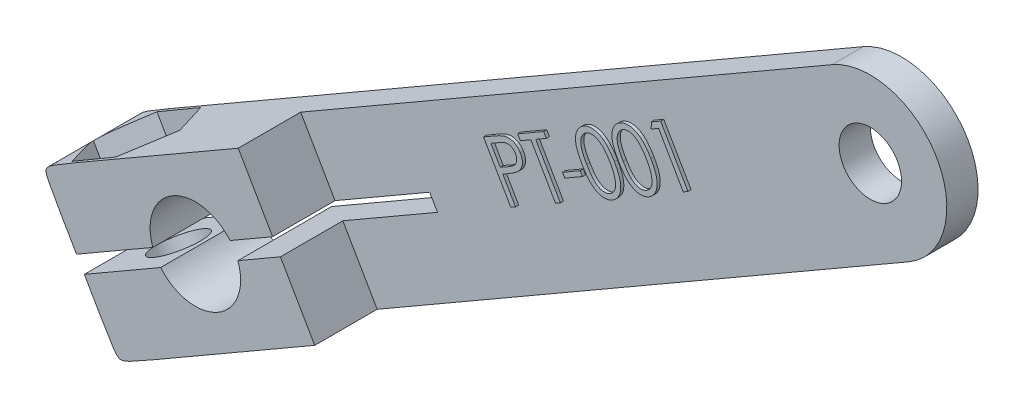
from build123d import *

# Parameters (mm, degrees)
SCHIZZO1_R                        = 2.9
SCHIZZO1_R_2                      = 2
ESTRUSIONE_ESTRUSIONE1_DEPTH      = 2
ESTRUSIONE_ESTRUSIONE2_DEPTH      = 4
ESTRUSIONE_ESTRUSIONE2_DEPTH_BACK = 2
SCHIZZO2_R                        = 2.9
TAGLIO_ESTRUSIONE1_START          = -6
TAGLIO_ESTRUSIONE1_DEPTH          = 6
SCHIZZO4_R                        = 1.6
TAGLIO_ESTRUSIONE2_DEPTH          = 13
TAGLIO_ESTRUSIONE3_DEPTH          = 2.4
TAGLIO_ESTRUSIONE4_DEPTH          = 3.5
RACCORDO2_SIZE                    = 2.5
ESTRUSIONE_ESTRUSIONE3_DEPTH      = 0.2


with BuildPart() as part:
    # Schizzo1 → Estrusione-Estrusione1 (new body)
    with BuildSketch(Plane.XY):
        with BuildLine():
            Line((2.45, -4.243524479), (41.680950791, 18.406475521))
            ThreePointArc((41.680950791, 18.406475521), (43.47447527, 25.1), (36.780950791, 26.893524479))
            Line((36.780950791, 26.893524479), (-2.45, 4.243524479))
            ThreePointArc((-2.45, 4.243524479), (-4.243524479, -2.45), (2.45, -4.243524479))
        make_face()
        Circle(SCHIZZO1_R, mode=Mode.SUBTRACT)
        with Locations((39.230950791, 22.65)):
            Circle(SCHIZZO1_R_2, mode=Mode.SUBTRACT)
    extrude(amount=ESTRUSIONE_ESTRUSIONE1_DEPTH)

    # Schizzo2 → Estrusione-Estrusione2 (add, two sides: drawn at the far end of the back side and taken through both)
    with BuildSketch(Plane.XY.offset(2).offset(-ESTRUSIONE_ESTRUSIONE2_DEPTH_BACK)):
        Polygon((-12.842304845, -1.756475521), (-7.942304845, -10.243524479), (7.646152423, -1.243524479), (2.746152423, 7.243524479), align=None)
        Circle(SCHIZZO2_R, mode=Mode.SUBTRACT)
    extrude(amount=ESTRUSIONE_ESTRUSIONE2_DEPTH + ESTRUSIONE_ESTRUSIONE2_DEPTH_BACK)

    # Schizzo3 → Taglio-Estrusione1 (cut)
    with BuildSketch(Plane.XY.offset(6).offset(TAGLIO_ESTRUSIONE1_START)):
        Polygon((11.008330249, 6.933012702), (4.946152423, 3.433012702), (5.446152423, 2.566987298), (11.508330249, 6.066987298), align=None)
        with BuildLine():
            Line((4.946152423, 3.433012702), (2.223863375, 1.861298388))
            ThreePointArc((2.223863375, 1.861298388), (2.511473671, 1.45), (2.723863375, 0.995272984))
            Line((2.723863375, 0.995272984), (5.446152423, 2.566987298))
            Line((5.446152423, 2.566987298), (4.946152423, 3.433012702))
        make_face()
        with BuildLine():
            ThreePointArc((-2.223863375, -1.861298388), (-2.376582804, -1.66188272), (-2.511473671, -1.45))
            Line((-2.511473671, -1.45), (-10.392304845, -6))
            Line((-10.392304845, -6), (-10.142304845, -6.433012702))
            Line((-10.142304845, -6.433012702), (-2.223863375, -1.861298388))
        make_face()
        with BuildLine():
            Line((-10.392304845, -6), (-2.511473671, -1.45))
            ThreePointArc((-2.511473671, -1.45), (-2.627524055, -1.227239723), (-2.723863375, -0.995272984))
            Line((-2.723863375, -0.995272984), (-10.642304845, -5.566987298))
            Line((-10.642304845, -5.566987298), (-10.392304845, -6))
        make_face()
    extrude(amount=TAGLIO_ESTRUSIONE1_DEPTH, mode=Mode.SUBTRACT)

    # Schizzo4 → Taglio-Estrusione2 (cut)
    with BuildSketch(Plane(origin=(2.45, -4.243524479, 0), x_dir=(0.8660254037844386, 0.5000000000000001, 0), z_dir=(0.5000000000000001, -0.8660254037844386, 0))):
        with Locations((-5, 3)):
            Circle(SCHIZZO4_R)
    extrude(amount=-TAGLIO_ESTRUSIONE2_DEPTH, mode=Mode.SUBTRACT)

    # Schizzo5 → Taglio-Estrusione3 (cut)
    with BuildSketch(Plane(origin=(-2.45, 4.243524479, 0), x_dir=(0.8660254037844386, 0.5000000000000003, 0), z_dir=(-0.5000000000000003, 0.8660254037844386, 0))):
        Polygon((-6.628973785, -0.267594464), (-8.1808195, -3.044529912), (-6.551845715, -5.776935448), (-3.371026215, -5.732405536), (-1.8191805, -2.955470088), (-3.448154285, -0.223064552), align=None)
    extrude(amount=-TAGLIO_ESTRUSIONE3_DEPTH, mode=Mode.SUBTRACT)

    # Schizzo6 → Taglio-Estrusione4 (cut)
    with BuildSketch(Plane(origin=(-10.392304845, -6, 0), x_dir=(0, 0, 1), z_dir=(-0.8660254037844385, -0.5000000000000004, 0))):
        Polygon((6, 4.9), (6, 0.5), (2, 0.5), (2, -0.5), (6, -0.5), (6, -4.9), (2, -4.9), (0, -4.9), (0, 4.9), (2, 4.9), align=None)
    extrude(amount=-TAGLIO_ESTRUSIONE4_DEPTH, mode=Mode.SUBTRACT)

    # Raccordo2
    # a fillet whose section is not a circle: 2.5 mm, written as the material it takes off along each edge
    with BuildSketch(Plane(origin=(-4.911215932, -8.493524479, -6.25), x_dir=(0.8660254037844352, 0.500000000000006, 0), z_dir=(0, 0, 1)), Plane(origin=(-9.811215932, -0.006475521, 12.25), x_dir=(0.8660254037844352, 0.500000000000006, 0), z_dir=(0, 0, -1))) as raccordo2_piece_1:
        with BuildLine():
            Bezier((RACCORDO2_SIZE, 0), (0, 0), (0, RACCORDO2_SIZE), weights=[1, 5.666666667, 1])
            Line((0, RACCORDO2_SIZE), (0, 0))
            Line((0, 0), (RACCORDO2_SIZE, 0))
        make_face()
    extrude(amount=18.5, mode=Mode.SUBTRACT)

    # Schizzo7 → Estrusione-Estrusione3 (add)
    # profile 1 of 6: a face of its own
    with BuildSketch(Plane.XY.offset(2)):
        with BuildLine():
            Line((14.654995983, 11.923657971), (15.258661848, 12.272115503))
            add(Edge.make_bspline(
                [(15.258661848, 12.272115503), (15.300199252, 12.296062866), (15.379710941, 12.341903363), (15.49480711, 12.405967766), (15.600367035, 12.461803713), (15.696128258, 12.510571645), (15.781872788, 12.551836711), (15.857909757, 12.585931874), (15.924221158, 12.612398451), (15.966013794, 12.625245926), (15.985024028, 12.631089862)],
                knots=[0, 0, 0, 0, 1.41763798, 2.713669593, 3.894493283, 4.948305046, 5.890974387, 6.707656998, 7.412151409, 8, 8, 8, 8], degree=3))
            add(Edge.make_bspline(
                [(15.985024028, 12.631089862), (16.009476955, 12.637551709), (16.058012193, 12.650377466), (16.131682799, 12.662671995), (16.204763374, 12.670027753), (16.277272429, 12.670737565), (16.349008963, 12.664968908), (16.420239163, 12.653608553), (16.491172644, 12.636976767), (16.560971017, 12.613722569), (16.62921227, 12.585158783), (16.694591436, 12.550093521), (16.756271399, 12.508389585), (16.815220059, 12.4613289), (16.869570151, 12.406776262), (16.921541702, 12.347214035), (16.970622429, 12.281664127), (16.999035705, 12.234064095), (17.013569701, 12.209715663)],
                knots=[0, 0, 0, 0, 1.006970065, 1.998678183, 2.971283936, 3.930160629, 4.882599096, 5.834537011, 6.800930537, 7.781213065, 8.761539793, 9.744470784, 10.730746285, 11.723720646, 12.744027512, 13.793144763, 14.871146497, 16, 16, 16, 16], degree=3))
            add(Edge.make_bspline(
                [(17.013569701, 12.209715663), (17.027580474, 12.184703935), (17.054948127, 12.135847793), (17.087515607, 12.060168678), (17.114769185, 11.985689722), (17.134464387, 11.911057044), (17.147105101, 11.836903108), (17.152871557, 11.763206537), (17.151477341, 11.689940411), (17.142891364, 11.617238562), (17.128363609, 11.545605098), (17.106818636, 11.47592327), (17.080610481, 11.407478648), (17.046471417, 11.341689521), (17.006890294, 11.277638989), (16.962130198, 11.214740518), (16.90985103, 11.154604013), (16.871708112, 11.116441675), (16.852311688, 11.097035375)],
                knots=[0, 0, 0, 0, 1.122828736, 2.193254318, 3.224643453, 4.228831758, 5.213617705, 6.169000406, 7.121745138, 8.080633842, 9.034478614, 9.981969644, 10.936166161, 11.902896885, 12.881572857, 13.88563584, 14.924804262, 16, 16, 16, 16], degree=3))
            add(Edge.make_bspline(
                [(16.852311688, 11.097035375), (16.835677964, 11.081849117), (16.799492904, 11.048812878), (16.736118193, 11.000322569), (16.66195324, 10.945294372), (16.574828928, 10.886216899), (16.476177132, 10.821583488), (16.364848352, 10.753253223), (16.242293353, 10.678528448), (16.155731035, 10.628283337), (16.110524829, 10.602043388)],
                knots=[0, 0, 0, 0, 0.604898426, 1.315898124, 2.142283095, 3.086283746, 4.14345829, 5.310927923, 6.595662065, 8, 8, 8, 8], degree=3))
            Line((16.110524829, 10.602043388), (15.894579316, 10.47794483))
            Line((15.894579316, 10.47794483), (16.707880598, 9.069391144))
            Line((16.707880598, 9.069391144), (16.404995983, 8.894110696))
            Line((16.404995983, 8.894110696), (14.654995983, 11.923657971))
        make_face()
        with BuildLine():
            Line((15.128253195, 11.804467266), (15.722804477, 10.774519349))
            Line((15.722804477, 10.774519349), (16.23953124, 11.064082651))
            add(Edge.make_bspline(
                [(16.23953124, 11.064082651), (16.264683131, 11.078569446), (16.313154228, 11.10648746), (16.380914973, 11.15067851), (16.44377454, 11.191520063), (16.499637922, 11.232068537), (16.54928623, 11.271566843), (16.592343358, 11.309955244), (16.630221172, 11.346319314), (16.6708419, 11.393540916), (16.711896632, 11.454368449), (16.75026298, 11.531107013), (16.773004361, 11.613256841), (16.784333469, 11.697974001), (16.783035006, 11.783811016), (16.768568568, 11.868532555), (16.742305739, 11.951358254), (16.71479556, 12.002790336), (16.700869381, 12.02882624)],
                knots=[0, 0, 0, 0, 1.14227034, 2.201309401, 3.183612238, 4.092622455, 4.917282292, 5.679715209, 6.362759515, 6.982399264, 8.128035595, 9.243012258, 10.343627153, 11.466432026, 12.598095752, 13.708166046, 14.839829772, 16, 16, 16, 16], degree=3))
            add(Edge.make_bspline(
                [(16.700869381, 12.02882624), (16.685405959, 12.053144329), (16.654915579, 12.101094114), (16.597796598, 12.164394381), (16.531916825, 12.218001783), (16.458699297, 12.26190436), (16.380565834, 12.294762906), (16.300022061, 12.315711294), (16.217857565, 12.322508717), (16.148311995, 12.318042553), (16.090245534, 12.306593258), (16.042172896, 12.293319655), (15.990066894, 12.274402266), (15.932909479, 12.25226191), (15.871770328, 12.22381222), (15.8056577, 12.191699121), (15.735546447, 12.154438643), (15.687904553, 12.127121067), (15.663209124, 12.112960856)],
                knots=[0, 0, 0, 0, 1.162641582, 2.292466936, 3.426387301, 4.582455347, 5.729194961, 6.839764135, 7.929592866, 9.04620529, 9.642419358, 10.318104597, 11.058617802, 11.880865065, 12.793487328, 13.781520127, 14.850039147, 16, 16, 16, 16], degree=3))
            Line((15.663209124, 12.112960856), (15.128253195, 11.804467266))
        make_face(mode=Mode.SUBTRACT)
    # profile 2 of 6: a face of its own
    with BuildSketch(Plane.XY.offset(2)):
        Polygon((17.013738008, 12.892608292), (16.843365412, 13.187079446), (18.505725188, 14.146915183), (18.676097784, 13.852444029), (18.000216373, 13.462620311), (19.579843777, 10.727544189), (19.270649066, 10.548758131), (17.691021662, 13.283834253), align=None)
    # profile 3 of 6: a face of its own
    with BuildSketch(Plane.XY.offset(2)):
        Polygon((19.716267207, 12.492267747), (20.849280027, 13.147115503), (20.994412239, 12.895412779), (19.861399418, 12.240565022), align=None)
    # profile 4 of 6: a face of its own
    with BuildSketch(Plane.XY.offset(2)):
        with BuildLine():
            add(Edge.make_bspline(
                [(20.971501353, 13.548858292), (20.943796032, 13.597506048), (20.889913233, 13.692118826), (20.817381905, 13.833231527), (20.752455352, 13.967625038), (20.696926863, 14.096005359), (20.65028946, 14.218032133), (20.613126804, 14.333957611), (20.583675286, 14.443546953), (20.564039142, 14.547904358), (20.552007791, 14.647715599), (20.546520936, 14.743721325), (20.546170229, 14.836692677), (20.552488118, 14.926676926), (20.56497966, 15.01365605), (20.583958354, 15.097600337), (20.609390856, 15.178364128), (20.640196005, 15.256208454), (20.676253876, 15.330616264), (20.719112831, 15.400012818), (20.76482116, 15.466302649), (20.816573068, 15.527207536), (20.872032861, 15.584750673), (20.933301655, 15.636868985), (20.998555455, 15.685914782), (21.04533082, 15.714305609), (21.068957282, 15.728645952)],
                knots=[0, 0, 0, 0, 1.642217524, 3.193873097, 4.653599743, 6.020219012, 7.296149585, 8.484364078, 9.590266645, 10.622995624, 11.596731579, 12.537641419, 13.442669779, 14.322439731, 15.181528583, 16.018162769, 16.844365298, 17.663022962, 18.472528165, 19.266229043, 20.053716379, 20.832379209, 21.608138827, 22.395685855, 23.18965321, 24, 24, 24, 24], degree=3))
            add(Edge.make_bspline(
                [(21.068957282, 15.728645952), (21.093522926, 15.742152267), (21.142223982, 15.768928354), (21.218485196, 15.80149194), (21.295294522, 15.829277338), (21.373955184, 15.849645252), (21.453681141, 15.863595144), (21.535022864, 15.871384594), (21.617539612, 15.87273004), (21.701186829, 15.867684843), (21.785699056, 15.856741644), (21.870323652, 15.837674565), (21.954684475, 15.811237929), (22.039527134, 15.779367461), (22.123143325, 15.738168881), (22.207131052, 15.690829999), (22.291364608, 15.637102145), (22.37483412, 15.574808126), (22.459254463, 15.505046184), (22.542786922, 15.425101678), (22.62668834, 15.335554615), (22.70970006, 15.236068752), (22.792453049, 15.126685106), (22.876196878, 15.008364642), (22.958478282, 14.879238821), (23.011794301, 14.789066437), (23.039109526, 14.742868708)],
                knots=[0, 0, 0, 0, 0.815881076, 1.617473213, 2.411751612, 3.192532544, 3.980223438, 4.766442947, 5.569622482, 6.380892254, 7.204795063, 8.048528362, 8.903143009, 9.777765604, 10.684831081, 11.614241792, 12.584586996, 13.591843045, 14.645331516, 15.771781295, 16.956234458, 18.217113798, 19.542884518, 20.949560407, 22.437178076, 24, 24, 24, 24], degree=3))
            add(Edge.make_bspline(
                [(23.039109526, 14.742868708), (23.06529593, 14.696263275), (23.116367136, 14.605368948), (23.186963488, 14.470181916), (23.247602263, 14.339134523), (23.300833876, 14.213302481), (23.344851617, 14.092258576), (23.381156663, 13.976089776), (23.408591154, 13.864643899), (23.427886494, 13.757601989), (23.438621176, 13.654470209), (23.445003734, 13.555246519), (23.44303436, 13.45923215), (23.436724427, 13.366364122), (23.422239608, 13.276731042), (23.402927197, 13.190137031), (23.37692841, 13.107095552), (23.344453908, 13.027772863), (23.306915736, 12.952172401), (23.263522434, 12.881153534), (23.216933842, 12.813627136), (23.164891281, 12.750698392), (23.106749143, 12.69349093), (23.045374972, 12.639327075), (22.978948673, 12.589548623), (22.931396458, 12.560815224), (22.907298628, 12.546254125)],
                knots=[0, 0, 0, 0, 1.558572261, 3.039675171, 4.44500239, 5.767404933, 7.021920233, 8.19867626, 9.314183841, 10.366093107, 11.366862767, 12.335955634, 13.262731656, 14.164729598, 15.047477431, 15.907015182, 16.749641984, 17.580952634, 18.403702246, 19.207672054, 20.005351578, 20.794016824, 21.584181799, 22.380929523, 23.179510693, 24, 24, 24, 24], degree=3))
            add(Edge.make_bspline(
                [(22.907298628, 12.546254125), (22.883162045, 12.533074839), (22.835236664, 12.506906169), (22.760914553, 12.47367809), (22.684664147, 12.448076555), (22.607767897, 12.427200078), (22.529282967, 12.414304182), (22.449890729, 12.406259607), (22.3690082, 12.405079868), (22.287133862, 12.409681891), (22.20495126, 12.422074917), (22.122626408, 12.439765638), (22.04115803, 12.466491707), (21.959462526, 12.498594355), (21.878032801, 12.538181735), (21.796655943, 12.584390703), (21.715915421, 12.638193006), (21.634565013, 12.698565345), (21.553743449, 12.768629957), (21.472001396, 12.848412073), (21.389528413, 12.938705642), (21.306938508, 13.040173975), (21.223269988, 13.151870709), (21.139757147, 13.274641101), (21.05432809, 13.407345535), (20.999666802, 13.500736508), (20.971501353, 13.548858292)],
                knots=[0, 0, 0, 0, 0.807491903, 1.603348545, 2.386916451, 3.167713854, 3.940658363, 4.719915701, 5.50935356, 6.313835313, 7.125313705, 7.947948844, 8.783651521, 9.640150085, 10.524255013, 11.440287308, 12.386399569, 13.372019105, 14.413529699, 15.525036669, 16.724996316, 18.002813491, 19.365932914, 20.822335035, 22.362637201, 24, 24, 24, 24], degree=3))
        make_face()
        with BuildLine():
            add(Edge.make_bspline(
                [(21.261064654, 13.708012939), (21.285124583, 13.666733055), (21.331715119, 13.586797161), (21.403440772, 13.473036292), (21.473555032, 13.368673016), (21.541226964, 13.273063842), (21.607723864, 13.187283475), (21.673111134, 13.111541349), (21.736086644, 13.044410654), (21.798221378, 12.986394531), (21.859993324, 12.936036079), (21.921737541, 12.891646656), (21.984128809, 12.85313397), (22.046608268, 12.819948923), (22.109680713, 12.792402832), (22.173013116, 12.769692097), (22.237255197, 12.753872494), (22.321390307, 12.738803909), (22.424706396, 12.733034404), (22.544089462, 12.74496112), (22.657067079, 12.774430478), (22.725295116, 12.809294803), (22.75936193, 12.826702843)],
                knots=[0, 0, 0, 0, 1.475228016, 2.856686104, 4.15161897, 5.357081144, 6.47289893, 7.501387829, 8.445726694, 9.313720896, 10.124066195, 10.905058304, 11.660046733, 12.386348828, 13.08755313, 13.783651734, 14.460982071, 15.127735434, 16.421461315, 17.639985157, 18.821625413, 20, 20, 20, 20], degree=3))
            add(Edge.make_bspline(
                [(22.75936193, 12.826702843), (22.791745586, 12.847584644), (22.856146431, 12.889111938), (22.938596188, 12.971417661), (23.00750223, 13.06773642), (23.053570568, 13.158376256), (23.081991718, 13.237069359), (23.099949338, 13.299476148), (23.111460495, 13.365048874), (23.118783, 13.432992952), (23.119546473, 13.50354414), (23.117155464, 13.576633921), (23.108549006, 13.652277837), (23.099237172, 13.703154298), (23.094498148, 13.729046593)],
                knots=[0, 0, 0, 0, 1.342886321, 2.670576022, 4.038999414, 5.466462105, 6.205051725, 6.959707281, 7.731476591, 8.527516338, 9.344012544, 10.193626534, 11.080691652, 12, 12, 12, 12], degree=3))
            add(Edge.make_bspline(
                [(23.094498148, 13.729046593), (23.087879458, 13.761857634), (23.074408882, 13.828635747), (23.046402922, 13.928817012), (23.013484452, 14.031597663), (22.974372566, 14.136167865), (22.928905441, 14.242575616), (22.878607033, 14.351288915), (22.821808822, 14.462180522), (22.779975744, 14.535724732), (22.758660808, 14.573197234)],
                knots=[0, 0, 0, 0, 0.879876913, 1.790754508, 2.73331625, 3.717259664, 4.725112015, 5.77538776, 6.866507818, 8, 8, 8, 8], degree=3))
            add(Edge.make_bspline(
                [(22.758660808, 14.573197234), (22.736980816, 14.610299784), (22.694562021, 14.682894161), (22.627601977, 14.786212524), (22.561954208, 14.883529577), (22.495370437, 14.973437223), (22.427985833, 15.055832745), (22.361499935, 15.132213948), (22.294147483, 15.20085681), (22.226686436, 15.262817673), (22.159383018, 15.31810726), (22.093010894, 15.367536558), (22.026470332, 15.409747703), (21.960693663, 15.446579668), (21.89492851, 15.476520319), (21.829910993, 15.500865011), (21.765142464, 15.518566716), (21.680733993, 15.532956301), (21.578032222, 15.538879241), (21.45943899, 15.528064173), (21.347553567, 15.498319071), (21.279958702, 15.463908655), (21.246341096, 15.44679499)],
                knots=[0, 0, 0, 0, 1.327522451, 2.597413504, 3.803087542, 4.954092809, 6.052504639, 7.091116491, 8.08170511, 9.022070092, 9.919800897, 10.771882377, 11.577119672, 12.352806521, 13.099205072, 13.807429758, 14.495830891, 15.170113202, 16.450227669, 17.661618134, 18.837030004, 20, 20, 20, 20], degree=3))
            add(Edge.make_bspline(
                [(21.246341096, 15.44679499), (21.213909712, 15.425956637), (21.149275455, 15.384426758), (21.067225993, 15.301076507), (20.996904192, 15.2042144), (20.951416306, 15.111829809), (20.921155016, 15.032500689), (20.904913495, 14.969093146), (20.891982621, 14.903611206), (20.884114839, 14.835382324), (20.882665683, 14.764605522), (20.884183235, 14.691491255), (20.892702617, 14.616210751), (20.904203956, 14.537628291), (20.922844828, 14.454663653), (20.949055785, 14.366221314), (20.983123597, 14.271679171), (21.023773572, 14.170522901), (21.072340839, 14.063582481), (21.128127373, 13.950261054), (21.190871461, 13.830574482), (21.237191051, 13.749697688), (21.261064654, 13.708012939)],
                knots=[0, 0, 0, 0, 1.186584607, 2.364808541, 3.584028067, 4.867913378, 5.52979883, 6.201670858, 6.884946004, 7.589109066, 8.317961587, 9.068444384, 9.84432244, 10.65432116, 11.518850237, 12.466086659, 13.499587148, 14.619373863, 15.830028341, 17.123623296, 18.517485242, 20, 20, 20, 20], degree=3))
        make_face(mode=Mode.SUBTRACT)
    # profile 5 of 6: a face of its own
    with BuildSketch(Plane.XY.offset(2)):
        with BuildLine():
            add(Edge.make_bspline(
                [(23.303108209, 14.895012138), (23.275402889, 14.943659895), (23.22152009, 15.038272672), (23.148988761, 15.179385373), (23.084062209, 15.313778884), (23.028533719, 15.442159206), (22.981896316, 15.56418598), (22.94473366, 15.680111457), (22.915282143, 15.789700799), (22.895645998, 15.894058204), (22.883614647, 15.993869445), (22.878127792, 16.089875171), (22.877777085, 16.182846524), (22.884094974, 16.272830772), (22.896586516, 16.359809896), (22.91556521, 16.443754183), (22.940997712, 16.524517974), (22.971802862, 16.6023623), (23.007860732, 16.67677011), (23.050719687, 16.746166664), (23.096428017, 16.812456495), (23.148179924, 16.873361382), (23.203639717, 16.930904519), (23.264908512, 16.983022832), (23.330162312, 17.032068628), (23.376937677, 17.060459455), (23.400564139, 17.074799798)],
                knots=[0, 0, 0, 0, 1.642217524, 3.193873097, 4.653599743, 6.020219012, 7.296149585, 8.484364078, 9.590266645, 10.622995624, 11.596731579, 12.537641419, 13.442669779, 14.322439731, 15.181528583, 16.018162769, 16.844365298, 17.663022962, 18.472528165, 19.266229043, 20.053716379, 20.832379209, 21.608138827, 22.395685855, 23.18965321, 24, 24, 24, 24], degree=3))
            add(Edge.make_bspline(
                [(23.400564139, 17.074799798), (23.425129782, 17.088306113), (23.473830838, 17.1150822), (23.550092052, 17.147645786), (23.626901379, 17.175431184), (23.70556204, 17.195799098), (23.785287998, 17.20974899), (23.86662972, 17.217538441), (23.949146469, 17.218883886), (24.032793686, 17.21383869), (24.117305913, 17.20289549), (24.201930509, 17.183828411), (24.286291331, 17.157391776), (24.37113399, 17.125521307), (24.454750181, 17.084322728), (24.538737909, 17.036983845), (24.622971465, 16.983255991), (24.706440976, 16.920961973), (24.790861319, 16.85120003), (24.874393778, 16.771255524), (24.958295196, 16.681708461), (25.041306917, 16.582222598), (25.124059906, 16.472838952), (25.207803734, 16.354518488), (25.290085138, 16.225392667), (25.343401157, 16.135220283), (25.370716382, 16.089022555)],
                knots=[0, 0, 0, 0, 0.815881076, 1.617473213, 2.411751612, 3.192532544, 3.980223438, 4.766442947, 5.569622482, 6.380892254, 7.204795063, 8.048528362, 8.903143009, 9.777765604, 10.684831081, 11.614241792, 12.584586996, 13.591843045, 14.645331516, 15.771781295, 16.956234458, 18.217113798, 19.542884518, 20.949560407, 22.437178076, 24, 24, 24, 24], degree=3))
            add(Edge.make_bspline(
                [(25.370716382, 16.089022555), (25.396902787, 16.042417121), (25.447973992, 15.951522794), (25.518570344, 15.816335762), (25.579209119, 15.68528837), (25.632440733, 15.559456327), (25.676458473, 15.438412422), (25.712763519, 15.322243622), (25.74019801, 15.210797745), (25.75949335, 15.103755835), (25.770228032, 15.000624055), (25.776610591, 14.901400365), (25.774641217, 14.805385996), (25.768331284, 14.712517968), (25.753846465, 14.622884888), (25.734534053, 14.536290877), (25.708535266, 14.453249398), (25.676060765, 14.37392671), (25.638522592, 14.298326247), (25.59512929, 14.22730738), (25.548540699, 14.159780982), (25.496498137, 14.096852238), (25.438355999, 14.039644776), (25.376981829, 13.985480921), (25.31055553, 13.935702469), (25.263003314, 13.906969071), (25.238905485, 13.892407971)],
                knots=[0, 0, 0, 0, 1.558572261, 3.039675171, 4.44500239, 5.767404933, 7.021920233, 8.19867626, 9.314183841, 10.366093107, 11.366862767, 12.335955634, 13.262731656, 14.164729598, 15.047477431, 15.907015182, 16.749641984, 17.580952634, 18.403702246, 19.207672054, 20.005351578, 20.794016824, 21.584181799, 22.380929523, 23.179510693, 24, 24, 24, 24], degree=3))
            add(Edge.make_bspline(
                [(25.238905485, 13.892407971), (25.214768901, 13.879228685), (25.166843521, 13.853060015), (25.09252141, 13.819831936), (25.016271003, 13.794230401), (24.939374753, 13.773353924), (24.860889823, 13.760458028), (24.781497586, 13.752413453), (24.700615056, 13.751233714), (24.618740718, 13.755835737), (24.536558117, 13.768228763), (24.454233264, 13.785919484), (24.372764887, 13.812645553), (24.291069383, 13.844748201), (24.209639657, 13.884335581), (24.1282628, 13.930544549), (24.047522277, 13.984346852), (23.966171869, 14.044719191), (23.885350305, 14.114783803), (23.803608252, 14.194565919), (23.721135269, 14.284859489), (23.638545364, 14.386327821), (23.554876844, 14.498024555), (23.471364003, 14.620794947), (23.385934946, 14.753499381), (23.331273658, 14.846890354), (23.303108209, 14.895012138)],
                knots=[0, 0, 0, 0, 0.807491903, 1.603348545, 2.386916451, 3.167713854, 3.940658363, 4.719915701, 5.50935356, 6.313835313, 7.125313705, 7.947948844, 8.783651521, 9.640150085, 10.524255013, 11.440287308, 12.386399569, 13.372019105, 14.413529699, 15.525036669, 16.724996316, 18.002813491, 19.365932914, 20.822335035, 22.362637201, 24, 24, 24, 24], degree=3))
        make_face()
        with BuildLine():
            add(Edge.make_bspline(
                [(23.59267151, 15.054166785), (23.616731439, 15.012886901), (23.663321976, 14.932951007), (23.735047628, 14.819190138), (23.805161888, 14.714826862), (23.872833821, 14.619217689), (23.93933072, 14.533437321), (24.00471799, 14.457695195), (24.067693501, 14.3905645), (24.129828235, 14.332548377), (24.19160018, 14.282189925), (24.253344397, 14.237800502), (24.315735665, 14.199287817), (24.378215124, 14.166102769), (24.44128757, 14.138556678), (24.504619972, 14.115845943), (24.568862053, 14.10002634), (24.652997163, 14.084957755), (24.756313252, 14.07918825), (24.875696318, 14.091114966), (24.988673935, 14.120584324), (25.056901973, 14.155448649), (25.090968786, 14.172856689)],
                knots=[0, 0, 0, 0, 1.475228016, 2.856686104, 4.15161897, 5.357081144, 6.47289893, 7.501387829, 8.445726694, 9.313720896, 10.124066195, 10.905058304, 11.660046733, 12.386348828, 13.08755313, 13.783651734, 14.460982071, 15.127735434, 16.421461315, 17.639985157, 18.821625413, 20, 20, 20, 20], degree=3))
            add(Edge.make_bspline(
                [(25.090968786, 14.172856689), (25.123352442, 14.19373849), (25.187753288, 14.235265784), (25.270203044, 14.317571507), (25.339109086, 14.413890266), (25.385177424, 14.504530102), (25.413598574, 14.583223206), (25.431556194, 14.645629994), (25.443067351, 14.71120272), (25.450389857, 14.779146798), (25.45115333, 14.849697986), (25.44876232, 14.922787767), (25.440155863, 14.998431683), (25.430844028, 15.049308144), (25.426105004, 15.075200439)],
                knots=[0, 0, 0, 0, 1.342886321, 2.670576022, 4.038999414, 5.466462105, 6.205051725, 6.959707281, 7.731476591, 8.527516338, 9.344012544, 10.193626534, 11.080691652, 12, 12, 12, 12], degree=3))
            add(Edge.make_bspline(
                [(25.426105004, 15.075200439), (25.419486314, 15.10801148), (25.406015738, 15.174789593), (25.378009778, 15.274970858), (25.345091309, 15.377751509), (25.305979423, 15.482321711), (25.260512297, 15.588729462), (25.210213889, 15.697442761), (25.153415679, 15.808334368), (25.1115826, 15.881878578), (25.090267664, 15.91935108)],
                knots=[0, 0, 0, 0, 0.879876913, 1.790754508, 2.73331625, 3.717259664, 4.725112015, 5.77538776, 6.866507818, 8, 8, 8, 8], degree=3))
            add(Edge.make_bspline(
                [(25.090267664, 15.91935108), (25.068587673, 15.956453631), (25.026168878, 16.029048008), (24.959208834, 16.13236637), (24.893561064, 16.229683423), (24.826977293, 16.319591069), (24.75959269, 16.401986591), (24.693106792, 16.478367794), (24.625754339, 16.547010656), (24.558293292, 16.608971519), (24.490989874, 16.664261106), (24.42461775, 16.713690404), (24.358077189, 16.755901549), (24.292300519, 16.792733514), (24.226535366, 16.822674165), (24.161517849, 16.847018857), (24.096749321, 16.864720563), (24.01234085, 16.879110148), (23.909639078, 16.885033087), (23.791045847, 16.874218019), (23.679160423, 16.844472918), (23.611565558, 16.810062501), (23.577947953, 16.792948837)],
                knots=[0, 0, 0, 0, 1.327522451, 2.597413504, 3.803087542, 4.954092809, 6.052504639, 7.091116491, 8.08170511, 9.022070092, 9.919800897, 10.771882377, 11.577119672, 12.352806521, 13.099205072, 13.807429758, 14.495830891, 15.170113202, 16.450227669, 17.661618134, 18.837030004, 20, 20, 20, 20], degree=3))
            add(Edge.make_bspline(
                [(23.577947953, 16.792948837), (23.545516568, 16.772110483), (23.480882311, 16.730580604), (23.398832849, 16.647230353), (23.328511048, 16.550368246), (23.283023162, 16.457983655), (23.252761872, 16.378654535), (23.236520351, 16.315246992), (23.223589477, 16.249765052), (23.215721696, 16.18153617), (23.214272539, 16.110759368), (23.215790091, 16.037645102), (23.224309473, 15.962364597), (23.235810813, 15.883782138), (23.254451684, 15.800817499), (23.280662642, 15.71237516), (23.314730453, 15.617833018), (23.355380428, 15.516676748), (23.403947695, 15.409736327), (23.45973423, 15.296414901), (23.522478317, 15.176728328), (23.568797907, 15.095851534), (23.59267151, 15.054166785)],
                knots=[0, 0, 0, 0, 1.186584607, 2.364808541, 3.584028067, 4.867913378, 5.52979883, 6.201670858, 6.884946004, 7.589109066, 8.317961587, 9.068444384, 9.84432244, 10.65432116, 11.518850237, 12.466086659, 13.499587148, 14.619373863, 15.830028341, 17.123623296, 18.517485242, 20, 20, 20, 20], degree=3))
        make_face(mode=Mode.SUBTRACT)
    # profile 6 of 6: a face of its own
    with BuildSketch(Plane.XY.offset(2)):
        Polygon((25.405448239, 18.130689221), (26.000700642, 18.474238901), (27.750700642, 15.444691625), (27.449919392, 15.27081342), (25.871694232, 18.003786176), (25.396333655, 17.729647555), align=None)
    extrude(amount=ESTRUSIONE_ESTRUSIONE3_DEPTH)


solid = part.part
